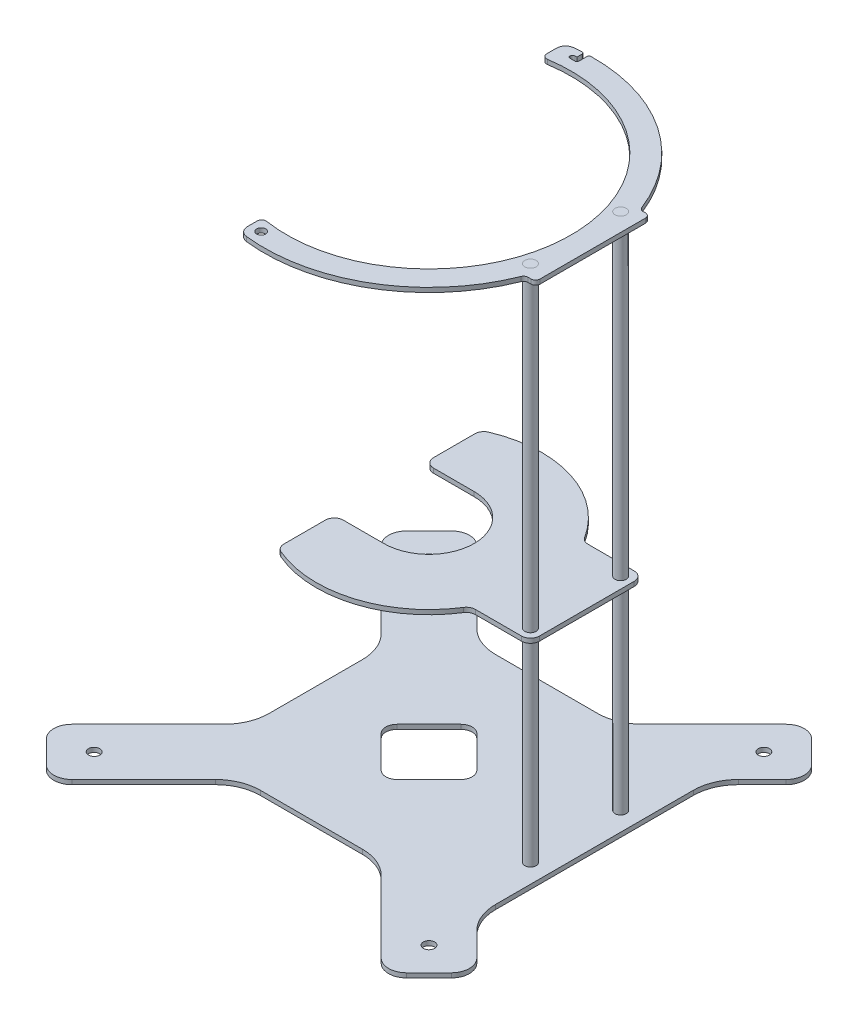
from build123d import *

# Parameters (mm, degrees)
SKETCH39_R               = 2.5
BASE_FLANGE3_DEPTH       = 2
BOSS_EXTRUDE1_DEPTH      = 140
BOSS_EXTRUDE1_DEPTH_BACK = 90
SKETCH42_R               = 2.5
SKETCH47_R               = 2.5
SKETCH47_R_2             = 2
BASE_FLANGE5_DEPTH       = 2
SKETCH48_R               = 2.5
BASE_FLANGE7_DEPTH       = 2


# Sheet-metal steps are written as plain solids
with BuildPart() as part:
    # Sketch39 → Base-Flange3 (new body)
    with BuildSketch(Plane(origin=(0, 0, 0), x_dir=(1, 0, 0), z_dir=(0, 1, 0))):
        with BuildLine():
            Line((0, -20), (-18, -20))
            ThreePointArc((-18, -20), (-20.828427125, -21.171572875), (-22, -24))
            Line((-22, -24), (-22, -42.332020977))
            ThreePointArc((-22, -42.332020977), (-21.336230625, -44.538730115), (-19.565217391, -46.013066279))
            ThreePointArc((-19.565217391, -46.013066279), (14.819641158, -47.753306021), (42.177933237, -26.851851852))
            ThreePointArc((42.177933237, -26.851851852), (43.627666998, -25.49339248), (45.552167896, -25))
            Line((45.552167896, -25), (66, -25))
            ThreePointArc((66, -25), (68.828427125, -23.828427125), (70, -21))
            Line((70, -21), (70, 21))
            ThreePointArc((70, 21), (68.828427125, 23.828427125), (66, 25))
            Line((66, 25), (45.552167896, 25))
            ThreePointArc((45.552167896, 25), (43.627666998, 25.49339248), (42.177933237, 26.851851852))
            ThreePointArc((42.177933237, 26.851851852), (14.819641158, 47.753306021), (-19.565217391, 46.013066279))
            ThreePointArc((-19.565217391, 46.013066279), (-21.336230625, 44.538730115), (-22, 42.332020977))
            Line((-22, 42.332020977), (-22, 24))
            ThreePointArc((-22, 24), (-20.828427125, 21.171572875), (-18, 20))
            Line((-18, 20), (0, 20))
            ThreePointArc((0, 20), (20, 0), (0, -20))
        make_face()
        with Locations(Location((65, -20, 0), (0, 0, 270))):
            Circle(SKETCH39_R, mode=Mode.SUBTRACT)
        with Locations(Location((65, 20, 0), (0, 0, 270))):
            Circle(SKETCH39_R, mode=Mode.SUBTRACT)
    extrude(amount=-BASE_FLANGE3_DEPTH)


with BuildPart() as body_2:
    # Sketch42 → Boss-Extrude1 (new, two sides: drawn at the far end of the back side and taken through both)
    with BuildSketch(Plane(origin=(0, 0, 0), x_dir=(1, 0, 0), z_dir=(0, 1, 0)).offset(-BOSS_EXTRUDE1_DEPTH_BACK)):
        with Locations(Location((65, -20, 0), (0, 0, 270))):
            Circle(SKETCH42_R)
    extrude(amount=BOSS_EXTRUDE1_DEPTH + BOSS_EXTRUDE1_DEPTH_BACK)


with BuildPart() as body_3:
    # Mirror2: mirrored copy
    add(body_2.part.mirror(Plane.XY))


with BuildPart() as body_4:
    # Sketch47 → Base-Flange5 (new body)
    with BuildSketch(Plane(origin=(0, 140, 0), x_dir=(1, 0, 0), z_dir=(0, 1, 0))):
        with BuildLine():
            Line((-12, 68.534662763), (-12, 64.226162893))
            ThreePointArc((-12, 64.226162893), (-11.300887271, 62.707053843), (-9.692307692, 62.249973266))
            ThreePointArc((-9.692307692, 62.249973266), (63, 0), (-9.692307692, -62.249973266))
            ThreePointArc((-9.692307692, -62.249973266), (-11.300887271, -62.707053843), (-12, -64.226162893))
            Line((-12, -64.226162893), (-12, -68.534662763))
            ThreePointArc((-12, -68.534662763), (-10.987898297, -71.19407318), (-8.463768116, -72.507686691))
            ThreePointArc((-8.463768116, -72.507686691), (37.398207021, -62.69269584), (67.823299831, -27))
            ThreePointArc((67.823299831, -27), (68.558853183, -26.08451425), (69.681472429, -25.739726027))
            Line((69.681472429, -25.739726027), (71, -25.739726027))
            ThreePointArc((71, -25.739726027), (72.414213562, -25.15393959), (73, -23.739726027))
            Line((73, -23.739726027), (73, 23))
            ThreePointArc((73, 23), (72.414213562, 24.414213562), (71, 25))
            Line((71, 25), (69.971422738, 25))
            ThreePointArc((69.971422738, 25), (68.840051888, 25.35075775), (68.105518132, 26.28))
            ThreePointArc((68.105518132, 26.28), (40.859539213, 60.493785262), (-1.053599414, 72.992396373))
            ThreePointArc((-1.053599414, 72.992396373), (-1.751357836, 72.694485978), (-2.039166545, 71.992500532))
            Line((-2.039166545, 71.992500532), (-2.039166545, 68.452227537))
            ThreePointArc((-2.039166545, 68.452227537), (-2.27348112, 67.886542112), (-2.839166545, 67.652227537))
            Line((-2.839166545, 67.652227537), (-4.039166545, 67.652227537))
            Line((-4.039166545, 67.652227537), (-5.2, 67.652227537))
            ThreePointArc((-5.2, 67.652227537), (-5.765685425, 67.886542112), (-6, 68.452227537))
            Line((-6, 68.452227537), (-6, 68.652227537))
            ThreePointArc((-6, 68.652227537), (-5.707106781, 69.359334318), (-5, 69.652227537))
            Line((-5, 69.652227537), (-4.039166545, 69.652227537))
            Line((-4.039166545, 69.652227537), (-4.039166545, 71.823441859))
            ThreePointArc((-4.039166545, 71.823441859), (-4.357253216, 72.554874845), (-5.109154969, 72.820989663))
            ThreePointArc((-5.109154969, 72.820989663), (-6.78826929, 72.683694183), (-8.463768116, 72.507686691))
            ThreePointArc((-8.463768116, 72.507686691), (-10.987898297, 71.19407318), (-12, 68.534662763))
        make_face()
        with Locations(Location((65, 20, 0), (0, 0, 270))):
            Circle(SKETCH47_R, mode=Mode.SUBTRACT)
        with Locations(Location((65, -20, 0), (0, 0, 270))):
            Circle(SKETCH47_R, mode=Mode.SUBTRACT)
        with Locations(Location((-7.0824173, -67.350554163, 0), (0, 0, 270))):
            Circle(SKETCH47_R_2, mode=Mode.SUBTRACT)
    extrude(amount=-BASE_FLANGE5_DEPTH)


with BuildPart() as body_5:
    # Sketch48 → Base-Flange7 (new body)
    with BuildSketch(Plane.XZ.offset(90)):
        with BuildLine():
            Line((79.903066274, 89.802561211), (89.802561211, 79.903066274))
            ThreePointArc((89.802561211, 79.903066274), (92.145706961, 74.246212025), (89.802561211, 68.589357775))
            Line((89.802561211, 68.589357775), (79.213968084, 58.000764649))
            ThreePointArc((79.213968084, 58.000764649), (74.878513058, 51.512297672), (73.356103708, 43.858629025))
            Line((73.356103708, 43.858629025), (73.356103708, -43.858629025))
            ThreePointArc((73.356103708, -43.858629025), (74.878513058, -51.512297672), (79.213968084, -58.000764649))
            Line((79.213968084, -58.000764649), (89.802561211, -68.589357775))
            ThreePointArc((89.802561211, -68.589357775), (92.145706961, -74.246212025), (89.802561211, -79.903066274))
            Line((89.802561211, -79.903066274), (79.903066274, -89.802561211))
            ThreePointArc((79.903066274, -89.802561211), (74.246212025, -92.145706961), (68.589357775, -89.802561211))
            Line((68.589357775, -89.802561211), (36.787561213, -58.000764649))
            ThreePointArc((36.787561213, -58.000764649), (30.299094237, -53.665309622), (22.645425589, -52.142900272))
            Line((22.645425589, -52.142900272), (-22.645425589, -52.142900272))
            ThreePointArc((-22.645425589, -52.142900272), (-30.299094237, -53.665309622), (-36.787561213, -58.000764649))
            Line((-36.787561213, -58.000764649), (-68.589357775, -89.802561211))
            ThreePointArc((-68.589357775, -89.802561211), (-74.246212025, -92.145706961), (-79.903066274, -89.802561211))
            Line((-79.903066274, -89.802561211), (-89.802561211, -79.903066274))
            ThreePointArc((-89.802561211, -79.903066274), (-92.145706961, -74.246212025), (-89.802561211, -68.589357775))
            Line((-89.802561211, -68.589357775), (-56.062445841, -34.849242405))
            ThreePointArc((-56.062445841, -34.849242405), (-51.726990814, -28.360775428), (-50.204581464, -20.707106781))
            Line((-50.204581464, -20.707106781), (-50.204581464, 20.707106781))
            ThreePointArc((-50.204581464, 20.707106781), (-51.726990814, 28.360775428), (-56.062445841, 34.849242405))
            Line((-56.062445841, 34.849242405), (-89.802561211, 68.589357775))
            ThreePointArc((-89.802561211, 68.589357775), (-92.145706961, 74.246212025), (-89.802561211, 79.903066274))
            Line((-89.802561211, 79.903066274), (-79.903066274, 89.802561211))
            ThreePointArc((-79.903066274, 89.802561211), (-74.246212025, 92.145706961), (-68.589357775, 89.802561211))
            Line((-68.589357775, 89.802561211), (-36.787561213, 58.000764649))
            ThreePointArc((-36.787561213, 58.000764649), (-30.299094236, 53.665309622), (-22.645425589, 52.142900272))
            Line((-22.645425589, 52.142900272), (22.645425589, 52.142900272))
            ThreePointArc((22.645425589, 52.142900272), (30.299094236, 53.665309622), (36.787561213, 58.000764649))
            Line((36.787561213, 58.000764649), (68.589357775, 89.802561211))
            ThreePointArc((68.589357775, 89.802561211), (74.246212025, 92.145706961), (79.903066274, 89.802561211))
        make_face()
        with Locations(Location((65, 20, 0), (0, 0, 270))):
            Circle(SKETCH48_R, mode=Mode.SUBTRACT)
        with Locations(Location((65, -20, 0), (0, 0, 270))):
            Circle(SKETCH48_R, mode=Mode.SUBTRACT)
        with Locations(Location((74.246212025, 74.246212025, 0), (0, 0, 270))):
            Circle(SKETCH48_R, mode=Mode.SUBTRACT)
        with Locations(Location((74.246212025, -74.246212025, 0), (0, 0, 270))):
            Circle(SKETCH48_R, mode=Mode.SUBTRACT)
        with Locations(Location((-74.246212025, -74.246212025, 0), (0, 0, 270))):
            Circle(SKETCH48_R, mode=Mode.SUBTRACT)
        with Locations(Location((-74.246212025, 74.246212025, 0), (0, 0, 270))):
            Circle(SKETCH48_R, mode=Mode.SUBTRACT)
        with BuildLine():
            Line((10.606601718, -10.606601718), (17.67766953, -3.535533906))
            ThreePointArc((17.67766953, -3.535533906), (19.142135624, 0), (17.67766953, 3.535533906))
            Line((17.67766953, 3.535533906), (10.606601718, 10.606601718))
            Line((10.606601718, 10.606601718), (3.535533906, 17.67766953))
            ThreePointArc((3.535533906, 17.67766953), (0, 19.142135624), (-3.535533906, 17.67766953))
            Line((-3.535533906, 17.67766953), (-10.606601718, 10.606601718))
            Line((-10.606601718, 10.606601718), (-17.67766953, 3.535533906))
            ThreePointArc((-17.67766953, 3.535533906), (-19.142135624, 0), (-17.67766953, -3.535533906))
            Line((-17.67766953, -3.535533906), (-10.606601718, -10.606601718))
            Line((-10.606601718, -10.606601718), (-3.535533906, -17.67766953))
            ThreePointArc((-3.535533906, -17.67766953), (0, -19.142135624), (3.535533906, -17.67766953))
            Line((3.535533906, -17.67766953), (10.606601718, -10.606601718))
        make_face(mode=Mode.SUBTRACT)
    extrude(amount=BASE_FLANGE7_DEPTH)


solid = Compound([part.part, body_2.part, body_3.part, body_4.part, body_5.part])
